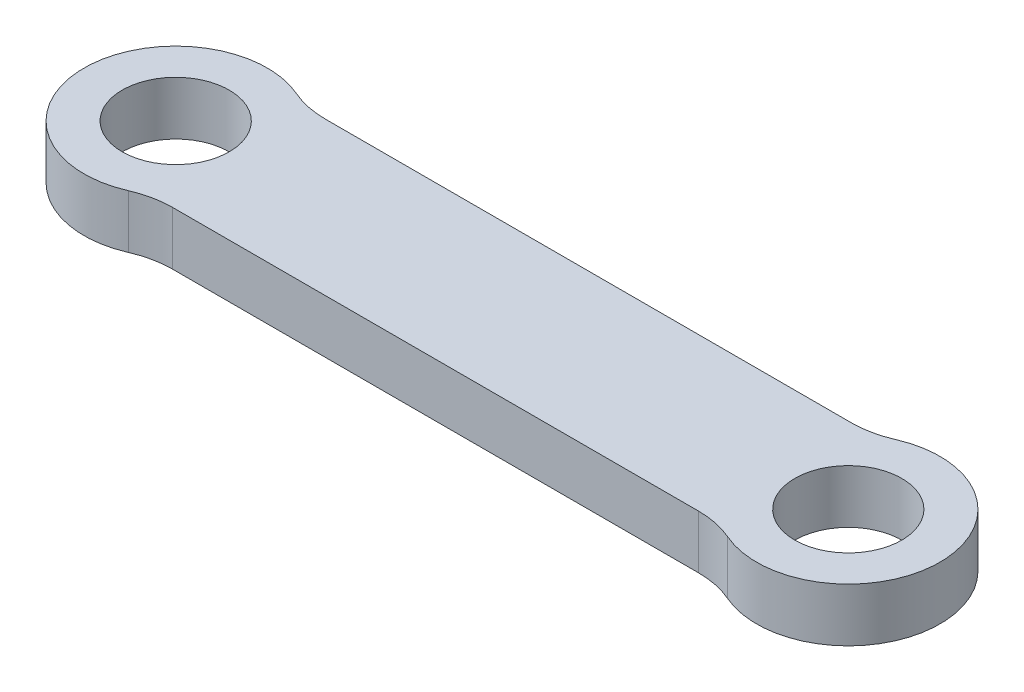
from build123d import *

# Parameters (mm, degrees)
SKETCH1_R           = 1.75
BOSS_EXTRUDE1_DEPTH = 1.75
FILLET1_R           = 3


with BuildPart() as part:
    # Sketch1 → Boss-Extrude1 (new body)
    with BuildSketch(Plane(origin=(0, 0, 0), x_dir=(1, 0, 0), z_dir=(0, 1, 0))):
        with BuildLine():
            ThreePointArc((1.658312395, 2.5), (-3, 0), (1.658312395, -2.5))
            Line((1.658312395, -2.5), (20.341687605, -2.5))
            ThreePointArc((20.341687605, -2.5), (25, 0), (20.341687605, 2.5))
            Line((20.341687605, 2.5), (1.658312395, 2.5))
        make_face()
        Circle(SKETCH1_R, mode=Mode.SUBTRACT)
        with Locations((22, 0)):
            Circle(SKETCH1_R, mode=Mode.SUBTRACT)
    extrude(amount=BOSS_EXTRUDE1_DEPTH)

    # Fillet1
    fillet1_edges = [part.edges().sort_by_distance(p)[0] for p in [
        (1.658312395, 0.875, 2.5),
        (20.341687605, 0.875, 2.5),
        (20.341687605, 0.875, -2.5),
        (1.658312395, 0.875, -2.5),
    ]]
    fillet(fillet1_edges, radius=FILLET1_R)


solid = part.part
